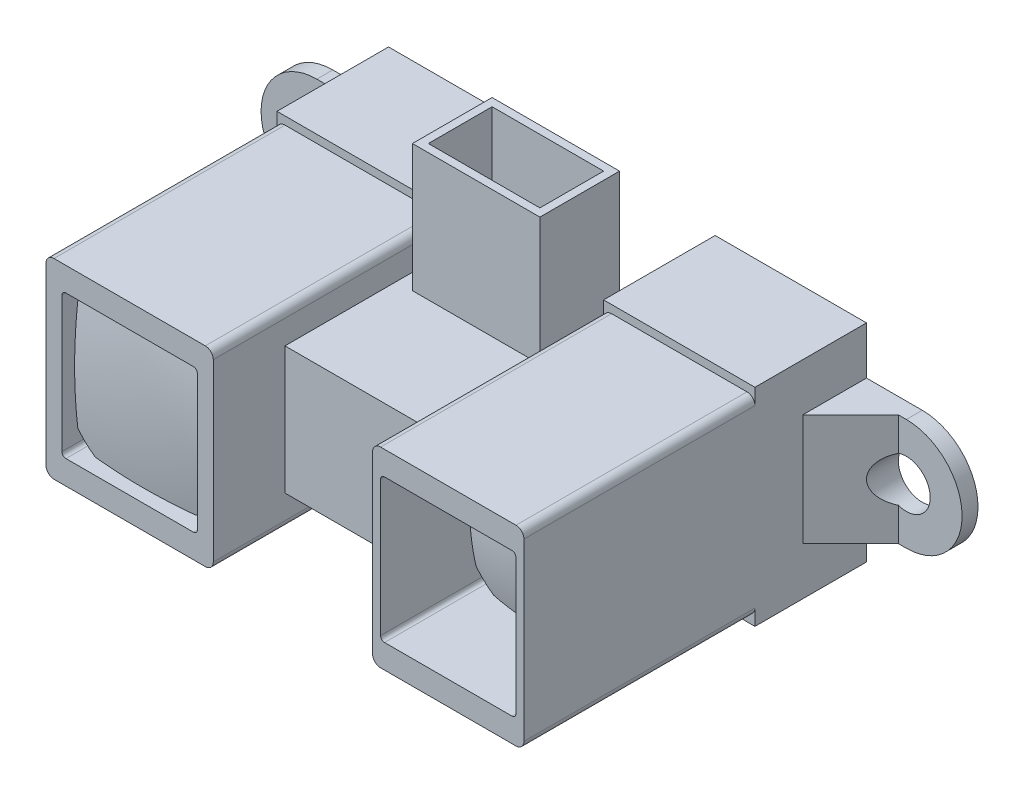
from build123d import *

# Parameters (mm, degrees)
SKETCH5_W           = 30
SKETCH5_H           = 13
BOSS_EXTRUDE1_DEPTH = 7
SKETCH6_W           = 10.5
SKETCH6_H           = 12
SKETCH6_W_2         = 8.5
SKETCH6_H_2         = 9
SKETCH6_W_3         = 9.5
BOSS_EXTRUDE2_DEPTH = 14.5
SKETCH7_W           = 10
SKETCH7_H           = 8
BOSS_EXTRUDE3_DEPTH = 10
FILLET1_R           = 0.25
FILLET2_R           = 0.5
SKETCH8_R           = 1.5
BOSS_EXTRUDE4_DEPTH = 1
CHAMFER1_SIZE       = 3
CUT_EXTRUDE1_START  = -16
CUT_EXTRUDE1_DEPTH  = 16
SKETCH12_OUTSIDE_W  = 56.134
SKETCH12_OUTSIDE_H  = 25.134
CUT_EXTRUDE2_DEPTH  = 2.5
SKETCH14_OUTSIDE_W  = 56.134
SKETCH14_OUTSIDE_H  = 25.134
CUT_EXTRUDE5_DEPTH  = 7
CUT_EXTRUDE6_DEPTH  = 6
SKETCH16_W          = 10
SKETCH16_H          = 2.5
CUT_EXTRUDE7_DEPTH  = 1
SKETCH17_W          = 8
SKETCH17_H          = 5
BOSS_EXTRUDE5_DEPTH = 8
SHELL1_T            = -0.5


with BuildPart() as part:
    # Sketch5 → Boss-Extrude1 (new body)
    with BuildSketch(Plane.XY):
        Rectangle(SKETCH5_W, SKETCH5_H)
    extrude(amount=BOSS_EXTRUDE1_DEPTH)

    # Sketch6 → Boss-Extrude2 (add)
    # profile 1 of 2: a face of its own
    with BuildSketch(Plane.XY.offset(7)):
        with Locations((-9.75, 0)):
            Rectangle(SKETCH6_W, SKETCH6_H)
        with Locations((-9.75, 0)):
            Rectangle(SKETCH6_W_2, SKETCH6_H_2, mode=Mode.SUBTRACT)
    # profile 2 of 2: a face of its own
    with BuildSketch(Plane.XY.offset(7)):
        with Locations((10.25, 0)):
            Rectangle(SKETCH6_W_3, SKETCH6_H)
        with Locations((10.25, 0)):
            Rectangle(SKETCH6_W_2, SKETCH6_H_2, mode=Mode.SUBTRACT)
    extrude(amount=BOSS_EXTRUDE2_DEPTH)

    # Sketch7 → Boss-Extrude3 (add)
    with BuildSketch(Plane.XY.offset(7)):
        with Locations((0.5, 0)):
            Rectangle(SKETCH7_W, SKETCH7_H)
    extrude(amount=BOSS_EXTRUDE3_DEPTH)

    # Fillet1
    fillet1_edges = [part.edges().sort_by_distance(p)[0] for p in [
        (-14, -4.5, 14.25),
        (-5.5, -4.5, 14.25),
        (-5.5, 4.5, 14.25),
        (-14, 4.5, 14.25),
        (6, -4.5, 14.25),
        (14.5, -4.5, 14.25),
        (14.5, 4.5, 14.25),
        (6, 4.5, 14.25),
    ]]
    fillet(fillet1_edges, radius=FILLET1_R)

    # Fillet2
    fillet2_edges = [part.edges().sort_by_distance(p)[0] for p in [
        (15, -6, 14.25),
        (5.5, -6, 14.25),
        (-4.5, -6, 14.25),
        (-15, -6, 14.25),
        (-15, 6, 14.25),
        (5.5, 6, 14.25),
        (15, 6, 14.25),
        (-4.5, 6, 14.25),
    ]]
    fillet(fillet2_edges, radius=FILLET2_R)

    # Sketch8 → Boss-Extrude4 (add)
    # profile 1 of 2: a face of its own
    with BuildSketch(Plane(origin=(0, 0, 0), x_dir=(-1, 0, 0), z_dir=(0, 0, -1))):
        with BuildLine():
            Line((-18.5, 3.5), (-15, 3.5))
            Line((-15, 3.5), (-15, -3.5))
            Line((-15, -3.5), (-18.5, -3.5))
            ThreePointArc((-18.5, -3.5), (-22, 0), (-18.5, 3.5))
        make_face()
        with Locations((-18.5, 0)):
            Circle(SKETCH8_R, mode=Mode.SUBTRACT)
    # profile 2 of 2: a face of its own
    with BuildSketch(Plane(origin=(0, 0, 0), x_dir=(-1, 0, 0), z_dir=(0, 0, -1))):
        with BuildLine():
            Line((15, -3.5), (18.5, -3.5))
            ThreePointArc((18.5, -3.5), (22, 0), (18.5, 3.5))
            Line((18.5, 3.5), (15, 3.5))
            Line((15, 3.5), (15, -3.5))
        make_face()
        with Locations(Location((18.5, 0, 0), (0, 0, 180))):
            Circle(SKETCH8_R, mode=Mode.SUBTRACT)
    extrude(amount=-BOSS_EXTRUDE4_DEPTH)

    # Chamfer1
    # the kernel refuses this chamfer: 3 mm, written as the material it adds along each edge
    with BuildSketch(Plane(origin=(15, 3.5, 1), x_dir=(-0.0274958766105862, 0, 0.9996219169112968), z_dir=(0, -1, 0))) as chamfer1_piece_1_section:
        Polygon((CHAMFER1_SIZE * 0.999621916911, -CHAMFER1_SIZE * 0.0274958766106), (-CHAMFER1_SIZE * 0.0274958766106, -CHAMFER1_SIZE * 0.999621916911), (0, 0), align=None)
    chamfer1_piece_1 = extrude(amount=7, mode=Mode.PRIVATE)
    chamfer1_piece_1 = chamfer1_piece_1 - Plane(origin=(18.5, 0, 2.014951553), x_dir=(-1, 0, 0), z_dir=(0, 0, -1)) * Cylinder(1.5, 26, mode=Mode.PRIVATE)
    add(chamfer1_piece_1)
    with BuildSketch(Plane(origin=(-15, 3.5, 1), x_dir=(0.0274958766105862, 0, 0.9996219169112968), z_dir=(0, -1, 0))) as chamfer1_piece_2_section:
        Polygon((CHAMFER1_SIZE * 0.999621916911, CHAMFER1_SIZE * 0.0274958766106), (-CHAMFER1_SIZE * 0.0274958766106, CHAMFER1_SIZE * 0.999621916911), (0, 0), align=None)
    chamfer1_piece_2 = extrude(amount=7, mode=Mode.PRIVATE)
    chamfer1_piece_2 = chamfer1_piece_2 - Plane(origin=(-18.5, 0, 2.014951553), x_dir=(1, 0, 0), z_dir=(0, 0, -1)) * Cylinder(1.5, 26, mode=Mode.PRIVATE)
    add(chamfer1_piece_2)

    # Sketch10 → Cut-Extrude1 (cut)
    with BuildSketch(Plane.XY.offset(17).offset(CUT_EXTRUDE1_START)):
        with BuildLine():
            Line((-17, 3.5), (-18.5, 3.5))
            ThreePointArc((-18.5, 3.5), (-22, 0), (-18.5, -3.5))
            Line((-18.5, -3.5), (-17, -3.5))
            Line((-17, -3.5), (-17, -3.16227766))
            ThreePointArc((-17, -3.16227766), (-15.541960108, -1.870828693), (-15, 0))
            ThreePointArc((-15, 0), (-15.541960108, 1.870828693), (-17, 3.16227766))
            Line((-17, 3.16227766), (-17, 3.5))
        make_face()
    extrude(amount=CUT_EXTRUDE1_DEPTH, mode=Mode.SUBTRACT)

    # Sketch15 → Cut-Extrude6 (cut)
    with BuildSketch(Plane(origin=(0, 0, 0), x_dir=(-1, 0, 0), z_dir=(0, 0, -1))):
        Polygon((14, -5.5), (-14, -5.5), (-14, 5.5), (-5.5, 5.5), (-5.5, 6.5), (4.5, 6.5), (4.5, 5.5), (14, 5.5), align=None)
    extrude(amount=-CUT_EXTRUDE6_DEPTH, mode=Mode.SUBTRACT)

    # Sketch16 → Cut-Extrude7 (cut)
    with BuildSketch(Plane(origin=(0, 0, 6), x_dir=(-1, 0, 0), z_dir=(0, 0, -1))):
        with Locations((-0.5, 5.25)):
            Rectangle(SKETCH16_W, SKETCH16_H)
    extrude(amount=-CUT_EXTRUDE7_DEPTH, mode=Mode.SUBTRACT)


with BuildPart() as body_2:
    # Sketch11 → Revolve1 (revolve)
    with BuildSketch(Plane(origin=(0, 0, 0), x_dir=(-1, 0, 0), z_dir=(0, 1, 0))):
        with BuildLine():
            Line((15.25, 20.5), (15.25, 19))
            Line((15.25, 19), (9.75, 19))
            Line((9.75, 19), (9.75, 21))
            ThreePointArc((9.75, 21), (12.511340254, 20.874742797), (15.25, 20.5))
        make_face()
    revolve(axis=Axis((-9.75, 0, 19), (0, 0, 1)))

    # Sketch12 outside → Cut-Extrude2 (cut)
    with BuildSketch(Plane.XY.offset(21.5)):
        Rectangle(SKETCH12_OUTSIDE_W, SKETCH12_OUTSIDE_H)
        with BuildLine():
            Line((-14, 4.25), (-14, -4.25))
            ThreePointArc((-14, -4.25), (-13.926776695, -4.426776695), (-13.75, -4.5))
            Line((-13.75, -4.5), (-5.75, -4.5))
            ThreePointArc((-5.75, -4.5), (-5.573223305, -4.426776695), (-5.5, -4.25))
            Line((-5.5, -4.25), (-5.5, 4.25))
            ThreePointArc((-5.5, 4.25), (-5.573223305, 4.426776695), (-5.75, 4.5))
            Line((-5.75, 4.5), (-13.75, 4.5))
            ThreePointArc((-13.75, 4.5), (-13.926776695, 4.426776695), (-14, 4.25))
        make_face(mode=Mode.SUBTRACT)
    extrude(amount=-CUT_EXTRUDE2_DEPTH, mode=Mode.SUBTRACT)


with BuildPart() as body_3:
    # Sketch13 → Revolve2 (revolve)
    with BuildSketch(Plane(origin=(0, 0, 0), x_dir=(-1, 0, 0), z_dir=(0, 1, 0))):
        with BuildLine():
            Line((-10.25, 14.5), (-15.75, 14.5))
            Line((-15.75, 14.5), (-15.75, 15.5))
            ThreePointArc((-15.75, 15.5), (-13.045084972, 16.247967345), (-10.25, 16.5))
            Line((-10.25, 16.5), (-10.25, 14.5))
        make_face()
    revolve(axis=Axis((10.25, 0, 16.5), (0, 0, -1)))

    # Sketch14 outside → Cut-Extrude5 (cut)
    with BuildSketch(Plane.XY.offset(21.5)):
        Rectangle(SKETCH14_OUTSIDE_W, SKETCH14_OUTSIDE_H)
        with BuildLine():
            Line((14.25, 4.5), (6.25, 4.5))
            ThreePointArc((6.25, 4.5), (6.073223305, 4.426776695), (6, 4.25))
            Line((6, 4.25), (6, -4.25))
            ThreePointArc((6, -4.25), (6.073223305, -4.426776695), (6.25, -4.5))
            Line((6.25, -4.5), (14.25, -4.5))
            ThreePointArc((14.25, -4.5), (14.426776695, -4.426776695), (14.5, -4.25))
            Line((14.5, -4.25), (14.5, 4.25))
            ThreePointArc((14.5, 4.25), (14.426776695, 4.426776695), (14.25, 4.5))
        make_face(mode=Mode.SUBTRACT)
    extrude(amount=-CUT_EXTRUDE5_DEPTH, mode=Mode.SUBTRACT)


with BuildPart() as body_4:
    # Sketch17 → Boss-Extrude5 (new body)
    with BuildSketch(Plane(origin=(0, 4, 0), x_dir=(1, 0, 0), z_dir=(0, 1, 0))):
        with Locations((0.5, -7.5)):
            Rectangle(SKETCH17_W, SKETCH17_H)
    extrude(amount=BOSS_EXTRUDE5_DEPTH)

    # Shell1
    shell1_openings = [body_4.faces().sort_by_distance(p)[0] for p in [
        (0.5, 12, 7.5),
    ]]
    offset(amount=SHELL1_T, openings=shell1_openings, kind=Kind.INTERSECTION)


solid = Compound([part.part, body_2.part, body_3.part, body_4.part])
